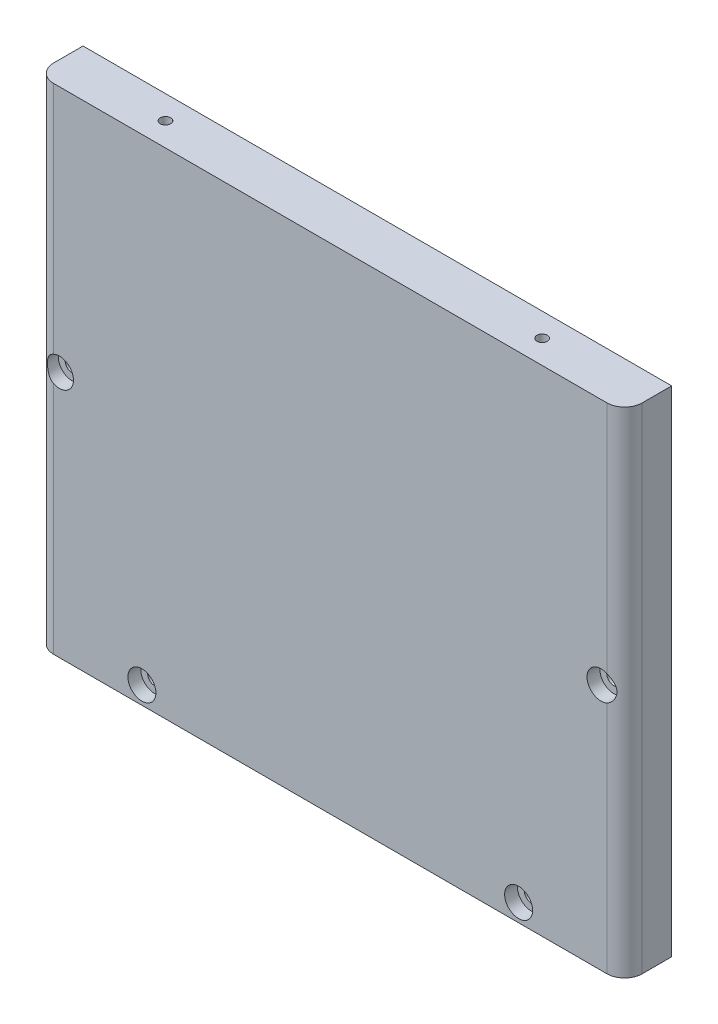
from build123d import *

# Parameters (mm, degrees)
SKETCH1_W                                      = 100
SKETCH1_H                                      = 84
BOSS_EXTRUDE1_DEPTH                            = 8
CBORE_FOR_2_SOCKET_HEAD_CAP_SCREW1_D           = 2.4384
CBORE_FOR_2_SOCKET_HEAD_CAP_SCREW1_DEPTH       = 12.27
CBORE_FOR_2_SOCKET_HEAD_CAP_SCREW1_CBORE_D     = 4.7625
CBORE_FOR_2_SOCKET_HEAD_CAP_SCREW1_CBORE_DEPTH = 2.1844
CBORE_FOR_2_SOCKET_HEAD_CAP_SCREW1_TIP         = 0.732569267
CBORE_FOR_2_SOCKET_HEAD_CAP_SCREW2_D           = 2.4384
CBORE_FOR_2_SOCKET_HEAD_CAP_SCREW2_DEPTH       = 12.27
CBORE_FOR_2_SOCKET_HEAD_CAP_SCREW2_CBORE_D     = 4.7625
CBORE_FOR_2_SOCKET_HEAD_CAP_SCREW2_CBORE_DEPTH = 2.1844
CBORE_FOR_2_SOCKET_HEAD_CAP_SCREW2_TIP         = 0.732569267
F_2_56_TAPPED_HOLE1_D                          = 1.778
F_2_56_TAPPED_HOLE1_DEPTH                      = 12
F_2_56_TAPPED_HOLE1_TIP                        = 0.53416509
FILLET1_R                                      = 3


with BuildPart() as part:
    # Sketch1 → Boss-Extrude1 (new body)
    with BuildSketch(Plane.XY):
        Rectangle(SKETCH1_W, SKETCH1_H)
    extrude(amount=BOSS_EXTRUDE1_DEPTH)

    # CBORE for #2 Socket Head Cap Screw1
    with Locations(Plane(origin=(-32, -39, 8), x_dir=(1, 0, 0), z_dir=(0, 0, 1))):
        with Locations((0, 0), (64, 0)):
            CounterBoreHole(CBORE_FOR_2_SOCKET_HEAD_CAP_SCREW1_D / 2, CBORE_FOR_2_SOCKET_HEAD_CAP_SCREW1_CBORE_D / 2, CBORE_FOR_2_SOCKET_HEAD_CAP_SCREW1_CBORE_DEPTH, depth=CBORE_FOR_2_SOCKET_HEAD_CAP_SCREW1_DEPTH)
            with Locations((0, 0, -(CBORE_FOR_2_SOCKET_HEAD_CAP_SCREW1_DEPTH + CBORE_FOR_2_SOCKET_HEAD_CAP_SCREW1_TIP / 2))):  # 118° drill point
                Cone(0, CBORE_FOR_2_SOCKET_HEAD_CAP_SCREW1_D / 2, CBORE_FOR_2_SOCKET_HEAD_CAP_SCREW1_TIP, mode=Mode.SUBTRACT)

    # CBORE for #2 Socket Head Cap Screw2
    with Locations(Plane(origin=(-46, 0, 8), x_dir=(1, 0, 0), z_dir=(0, 0, 1))):
        with Locations((0, 0), (92, 0)):
            CounterBoreHole(CBORE_FOR_2_SOCKET_HEAD_CAP_SCREW2_D / 2, CBORE_FOR_2_SOCKET_HEAD_CAP_SCREW2_CBORE_D / 2, CBORE_FOR_2_SOCKET_HEAD_CAP_SCREW2_CBORE_DEPTH, depth=CBORE_FOR_2_SOCKET_HEAD_CAP_SCREW2_DEPTH)
            with Locations((0, 0, -(CBORE_FOR_2_SOCKET_HEAD_CAP_SCREW2_DEPTH + CBORE_FOR_2_SOCKET_HEAD_CAP_SCREW2_TIP / 2))):  # 118° drill point
                Cone(0, CBORE_FOR_2_SOCKET_HEAD_CAP_SCREW2_D / 2, CBORE_FOR_2_SOCKET_HEAD_CAP_SCREW2_TIP, mode=Mode.SUBTRACT)

    # #2-56 Tapped Hole1
    with Locations(Plane(origin=(-32, 42, 4), x_dir=(0, 0, 1), z_dir=(0, 1, 0))):
        with Locations((0, 0), (0, 64)):
            Hole(F_2_56_TAPPED_HOLE1_D / 2, depth=F_2_56_TAPPED_HOLE1_DEPTH)
            with Locations((0, 0, -(F_2_56_TAPPED_HOLE1_DEPTH + F_2_56_TAPPED_HOLE1_TIP / 2))):  # 118° drill point
                Cone(0, F_2_56_TAPPED_HOLE1_D / 2, F_2_56_TAPPED_HOLE1_TIP, mode=Mode.SUBTRACT)

    # Fillet1
    # the kernel refuses this fillet: 3 mm, written as the material it takes off along each edge
    with BuildSketch(Plane(origin=(-50, -49.5, 8), x_dir=(0, 0, -1), z_dir=(0, 1, 0))) as fillet1_piece_1:
        with BuildLine():
            CenterArc((FILLET1_R, -FILLET1_R), FILLET1_R, 90, 90)
            Line((0, -FILLET1_R), (0, 0))
            Line((0, 0), (FILLET1_R, 0))
        make_face()
    extrude(amount=99, mode=Mode.SUBTRACT)
    with BuildSketch(Plane(origin=(50, 49.5, 8), x_dir=(-1, 0, 0), z_dir=(0, -1, 0))) as fillet1_piece_2:
        with BuildLine():
            CenterArc((FILLET1_R, FILLET1_R), FILLET1_R, 180, 90)
            Line((0, FILLET1_R), (0, 0))
            Line((0, 0), (FILLET1_R, 0))
        make_face()
    extrude(amount=99, mode=Mode.SUBTRACT)


solid = part.part
